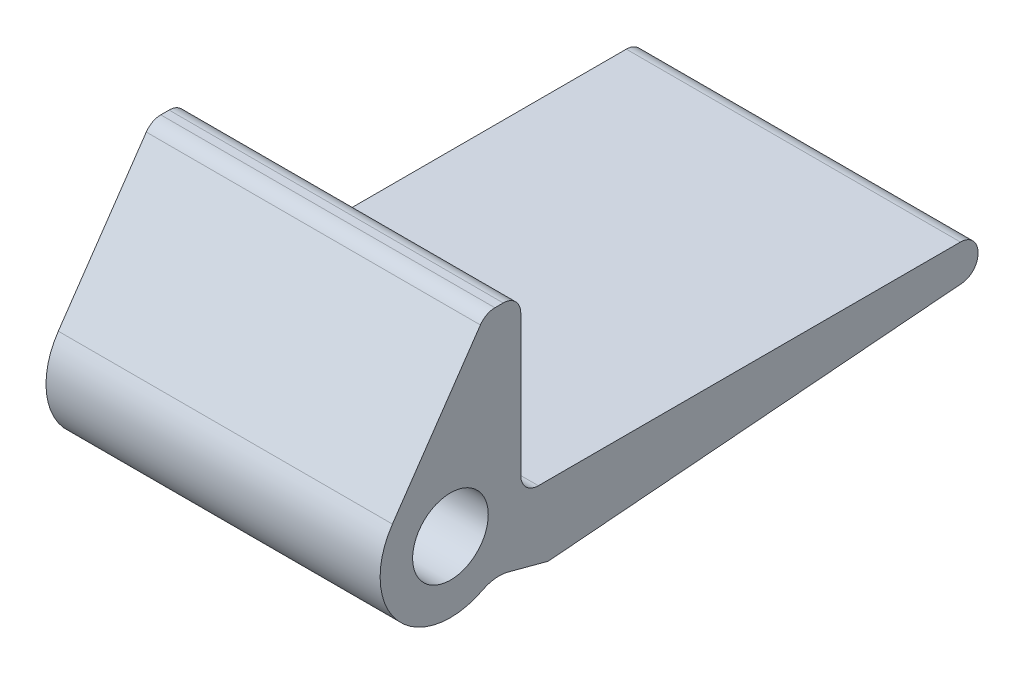
from build123d import *

# Parameters (mm, degrees)
SKETCH1_R           = 2.15
BOSS_EXTRUDE1_DEPTH = 9.5
FILLET1_R           = 2
FILLET2_R           = 1
FILLET3_R           = 1


with BuildPart() as part:
    # Sketch1 → Boss-Extrude1 (new, symmetric)
    with BuildSketch(Plane(origin=(0, 0, 0), x_dir=(0, 0, -1), z_dir=(1, 0, 0))):
        with BuildLine():
            Line((2.440170313, -3.169474538), (5.553949343, -4))
            Line((5.553949343, -4), (30, -1.999999999))
            Line((30, -1.999999999), (30, 2e-09))
            Line((30, 2e-09), (3.999999993, 2e-09))
            Line((3.999999993, 2e-09), (3.999999993, 10.000000002))
            Line((3.999999993, 10.000000002), (1.999999997, 10.000000002))
            Line((1.999999997, 10.000000002), (-3.300319816, 2.260063962))
            ThreePointArc((-3.300319816, 2.260063962), (-2.748624451, -2.906039165), (2.440170313, -3.169474538))
        make_face()
        Circle(SKETCH1_R, mode=Mode.SUBTRACT)
    extrude(amount=BOSS_EXTRUDE1_DEPTH, both=True)

    # Fillet1
    fillet1_edges = [part.edges().sort_by_distance(p)[0] for p in [
        (0, -3.169474538, -2.440170313),
    ]]
    fillet(fillet1_edges, radius=FILLET1_R)

    # Fillet2
    fillet2_edges = [part.edges().sort_by_distance(p)[0] for p in [
        (0, 2e-09, -30),
        (0, 10.000000002, -3.999999993),
        (0, 2e-09, -3.999999993),
    ]]
    fillet(fillet2_edges, radius=FILLET2_R)

    # Fillet3
    fillet3_edges = [part.edges().sort_by_distance(p)[0] for p in [
        (0, -1.999999999, -30),
        (0, 10.000000002, -1.999999997),
    ]]
    fillet(fillet3_edges, radius=FILLET3_R)


solid = part.part
